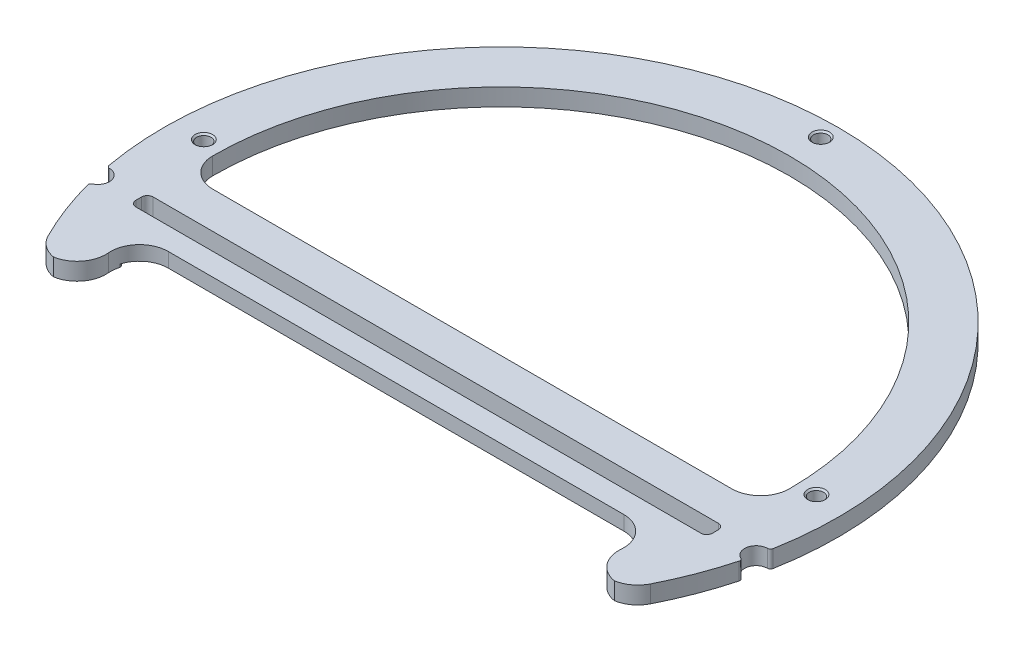
from build123d import *

# Parameters (mm, degrees)
SKETCH_2_R                   = 58.5
EXTRUDE_1_DEPTH              = 3
CUT_EXTRUDE_2_DEPTH          = 83.785868359
CUT_EXTRUDE_3_DEPTH          = 83.785868359
SKETCH_5_W                   = 107.181767534
SKETCH_5_H                   = 58.876454488
CUT_EXTRUDE_8_DEPTH          = 83.785868359
FILLET_2_R                   = 5
CUT_EXTRUDE_9_DEPTH          = 83.785868359
FILLET_4_R                   = 5
FILLET_7_R                   = 5
SKETCH_8_W                   = 104
SKETCH_8_H                   = 7.45940389
CUT_EXTRUDE_10_DEPTH         = 0.5
FILLET_8_R                   = 0.5
SKETCH_9_R                   = 2
CUT_EXTRUDE_11_DEPTH         = 10
FILLET_9_R                   = 0.5
HOLE_WIZARD_M3_1_D           = 2.5
HOLE_WIZARD_M3_1_DEPTH       = 3.9
HOLE_WIZARD_M3_1_CSINK_D     = 3.05
HOLE_WIZARD_M3_1_CSINK_ANGLE = 90
HOLE_WIZARD_M3_1_TIP         = 0.751075774


with BuildPart() as part:
    # 草图2 → 凸台-拉伸1 (new body)
    with BuildSketch(Plane(origin=(0, 0, 0), x_dir=(1, 0, 0), z_dir=(0, 1, 0))):
        with Locations(Location((0, 0, 0), (0, 0, 270))):
            Circle(SKETCH_2_R)
    extrude(amount=EXTRUDE_1_DEPTH)

    # 草图3 → 切除-拉伸2 (cut, through all)
    with BuildSketch(Plane.XZ):
        with BuildLine():
            Line((-49.749371855, 5), (49.749371855, 5))
            ThreePointArc((49.749371855, 5), (0, -50), (-49.749371855, 5))
        make_face()
    extrude(amount=-CUT_EXTRUDE_2_DEPTH, mode=Mode.SUBTRACT)

    # 草图4 → 切除-拉伸3 (cut, through all)
    with BuildSketch(Plane(origin=(0, 0, 0), x_dir=(-1, 0, 0), z_dir=(0, -1, 0))):
        with BuildLine():
            Line((-46.56392527, -18.215401819), (46.56392527, -18.215401819))
            ThreePointArc((46.56392527, -18.215401819), (0, -50), (-46.56392527, -18.215401819))
        make_face()
    extrude(amount=-CUT_EXTRUDE_3_DEPTH, mode=Mode.SUBTRACT)

    # 草图5 → 切除-拉伸8 (cut, through all)
    with BuildSketch(Plane(origin=(0, 0, 0), x_dir=(1, 0, 0), z_dir=(0, 1, 0))):
        with Locations((0, -58.5)):
            Rectangle(SKETCH_5_W, SKETCH_5_H)
    extrude(amount=CUT_EXTRUDE_8_DEPTH, mode=Mode.SUBTRACT)

    # 圆角2
    # the kernel refuses this fillet: 5 mm, written as the material it takes off along each edge
    with BuildSketch(Plane(origin=(-50.770693951, 10.80866432, 29.061772756), x_dir=(-0.473436338201062, 0, -0.8808280386492982), z_dir=(0, -1, 0))) as fillet_2_piece_1:
        with BuildLine():
            CenterArc((2.989984287, 4.998217953), FILLET_2_R, 208.257588903, 63.272177489)
            Line((-1.414155907, 2.631036262), (0, 0))
            ThreePointArc((0, 0), (1.561732864, -0.020849951), (3.123465728, 0))
        make_face()
    extrude(amount=18.61732864, mode=Mode.SUBTRACT)
    with BuildSketch(Plane(origin=(50.770693951, 10.80866432, 29.061772756), x_dir=(0.47343633820105957, 0, -0.8808280386492995), z_dir=(0, -1, 0))) as fillet_2_piece_2:
        with BuildLine():
            CenterArc((2.989984287, -4.998217953), FILLET_2_R, 88.470233608, 63.272177489)
            Line((-1.414155907, -2.631036262), (0, 0))
            ThreePointArc((0, 0), (1.561732864, 0.020849951), (3.123465728, 0))
        make_face()
    extrude(amount=18.61732864, mode=Mode.SUBTRACT)
    with BuildSketch(Plane(origin=(-40.686771367, 24.926487598, 29.061772756), x_dir=(-1, 0, 0), z_dir=(0, -1, 0))) as fillet_2_piece_3:
        with BuildLine():
            CenterArc((8.770595039, 5), FILLET_2_R, 154.056362734, 115.943637266)
            ThreePointArc((4.27447082, 7.187433887), (2.287760136, 3.504197713), (0, 0))
            Line((0, 0), (8.770595039, 0))
        make_face()
    extrude(amount=46.852975195, mode=Mode.SUBTRACT)
    with BuildSketch(Plane(origin=(40.686771367, 24.926487598, 29.061772756), x_dir=(1, 0, 0), z_dir=(0, -1, 0))) as fillet_2_piece_4:
        with BuildLine():
            CenterArc((8.770595039, -5), FILLET_2_R, 90, 115.943637266)
            ThreePointArc((4.27447082, -7.187433887), (2.287760136, -3.504197713), (0, 0))
            Line((0, 0), (8.770595039, 0))
        make_face()
    extrude(amount=46.852975195, mode=Mode.SUBTRACT)

    # 草图6 → 切除-拉伸9 (cut, through all)
    with BuildSketch(Plane.XZ):
        with BuildLine():
            Line((-50, 13.34), (-50, 12.34))
            ThreePointArc((-50, 12.34), (-49.707106781, 11.632893219), (-49, 11.34))
            Line((-49, 11.34), (49, 11.34))
            ThreePointArc((49, 11.34), (49.707106781, 11.632893219), (50, 12.34))
            Line((50, 12.34), (50, 13.34))
            ThreePointArc((50, 13.34), (49.707106781, 14.047106781), (49, 14.34))
            Line((49, 14.34), (-49, 14.34))
            ThreePointArc((-49, 14.34), (-49.707106781, 14.047106781), (-50, 13.34))
        make_face()
    extrude(amount=-CUT_EXTRUDE_9_DEPTH, mode=Mode.SUBTRACT)

    # 圆角4
    fillet_4_edges = [part.edges().sort_by_distance(p)[0] for p in [
        (49.749371855, 1.5, 5),
        (-49.749371855, 1.5, 5),
    ]]
    fillet(fillet_4_edges, radius=FILLET_4_R)

    # 圆角7
    fillet_7_edges = [part.edges().sort_by_distance(p)[0] for p in [
        (46.56392527, 1.5, 18.215401819),
        (-46.56392527, 1.5, 18.215401819),
    ]]
    fillet(fillet_7_edges, radius=FILLET_7_R)

    # 草图8 → 切除-拉伸10 (cut)
    with BuildSketch(Plane.XZ):
        with Locations((0, 17.517014665)):
            Rectangle(SKETCH_8_W, SKETCH_8_H)
    extrude(amount=-CUT_EXTRUDE_10_DEPTH, mode=Mode.SUBTRACT)

    # 圆角8
    fillet_8_edges = [part.edges().sort_by_distance(p)[0] for p in [
        (44.089363562, 0.251583272, 21.24671661),
    ]]
    fillet(fillet_8_edges, radius=FILLET_8_R)
    fillet_8_2_edges = [part.edges().sort_by_distance(p)[0] for p in [
        (52, 0.25, 21.24671661),
    ]]
    fillet(fillet_8_2_edges, radius=FILLET_8_R)
    fillet_8_3_edges = [part.edges().sort_by_distance(p)[0] for p in [
        (52, 0.25, 13.78731272),
    ]]
    fillet(fillet_8_3_edges, radius=FILLET_8_R)
    fillet_8_4_edges = [part.edges().sort_by_distance(p)[0] for p in [
        (-52, 0.25, 21.24671661),
    ]]
    fillet(fillet_8_4_edges, radius=FILLET_8_R)
    fillet_8_5_edges = [part.edges().sort_by_distance(p)[0] for p in [
        (-44.089363562, 0.255447628, 21.24671661),
    ]]
    fillet(fillet_8_5_edges, radius=FILLET_8_R)
    # the kernel refuses this fillet: 0.5 mm, written as the material it takes off along each edge
    with BuildSketch(Plane(origin=(49.894377622, 0.5, 13.78731272), x_dir=(0.20668352774517387, 0, -0.9784078491911283), z_dir=(0, -1, 0))) as fillet_8_6_piece_1:
        with BuildLine():
            CenterArc((0.614376094, 0.489203925), FILLET_8_R, 168.071931058, 90)
            Line((0.12517217, 0.592545688), (0.076251777, 0.602879865))
            Line((0.076251777, 0.602879865), (-0.048920392, 0.010334176))
            Line((-0.048920392, 0.010334176), (0.012640058, -0.048375913))
            ThreePointArc((0.012640058, -0.048375913), (0.449150506, -0.0380308), (0.500700154, -0.048920392))
            Line((0.500700154, -0.048920392), (0.51103433, 0))
        make_face()
    extrude(amount=2.014055945, mode=Mode.SUBTRACT)
    # the kernel refuses this fillet: 0.5 mm, written as the material it takes off along each edge
    with BuildSketch(Plane(origin=(-49.894377622, 0.5, 13.78731272), x_dir=(-1, 0, 0), z_dir=(0, -1, 0))) as fillet_8_7_piece_1:
        with BuildLine():
            CenterArc((0.605622378, 0.5), FILLET_8_R, 180, 90)
            Line((0.105622378, 0.5), (0.055622378, 0.5))
            ThreePointArc((0.055622378, 0.5), (0.055622378, 0.44731272), (-0.044718881, 0.022365636))
            Line((-0.044718881, 0.022365636), (0, -0.05))
            Line((0, -0.05), (0.605622378, -0.05))
            Line((0.605622378, -0.05), (0.605622378, 0))
        make_face()
    extrude(amount=2.014055945, mode=Mode.SUBTRACT)

    # 草图9 → 切除-拉伸11 (cut)
    with BuildSketch(Plane(origin=(0, 3, 0), x_dir=(1, 0, 0), z_dir=(0, 1, 0))):
        with Locations((57.07349998, -12.84)):
            Circle(SKETCH_9_R)
        with Locations((-57.07349998, -12.84)):
            Circle(SKETCH_9_R)
    extrude(amount=-CUT_EXTRUDE_11_DEPTH, mode=Mode.SUBTRACT)

    # 圆角9
    fillet_9_edges = [part.edges().sort_by_distance(p)[0] for p in [
        (56.601235389, 1.5, 14.783441832),
        (57.479055827, 1.5, 10.881550497),
        (-57.479055827, 1.5, 10.881550497),
        (-56.601235389, 1.5, 14.783441832),
    ]]
    fillet(fillet_9_edges, radius=FILLET_9_R)

    # M3 螺纹孔1
    with Locations(Plane(origin=(0, 3, 0), x_dir=(1, 0, 0), z_dir=(0, 1, 0))):
        with Locations((53.213363577, 1.475326476), (-53.213363577, 1.668639438), (-0.086594156, 55.526064592), (68.846840655, 52.777963262)):
            CounterSinkHole(HOLE_WIZARD_M3_1_D / 2, HOLE_WIZARD_M3_1_CSINK_D / 2, depth=HOLE_WIZARD_M3_1_DEPTH, counter_sink_angle=HOLE_WIZARD_M3_1_CSINK_ANGLE)
            with Locations((0, 0, -(HOLE_WIZARD_M3_1_DEPTH + HOLE_WIZARD_M3_1_TIP / 2))):  # 118° drill point
                Cone(0, HOLE_WIZARD_M3_1_D / 2, HOLE_WIZARD_M3_1_TIP, mode=Mode.SUBTRACT)


solid = part.part
